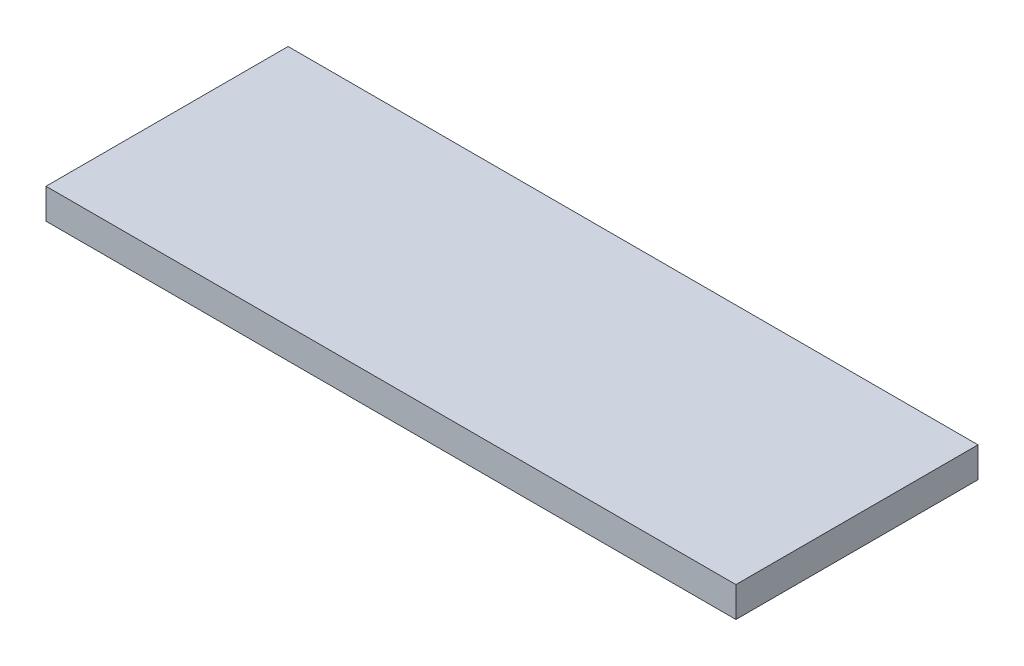
from build123d import *

# Parameters (mm, degrees)
SKETCH_1_W      = 114
SKETCH_1_H      = 40
EXTRUDE_1_DEPTH = 5


with BuildPart() as part:
    # ｽｹｯﾁ1 → ﾎﾞｽ - 押し出し1 (new body)
    with BuildSketch(Plane(origin=(0, 0, 0), x_dir=(1, 0, 0), z_dir=(0, 1, 0))):
        Rectangle(SKETCH_1_W, SKETCH_1_H)
    extrude(amount=EXTRUDE_1_DEPTH)


solid = part.part
